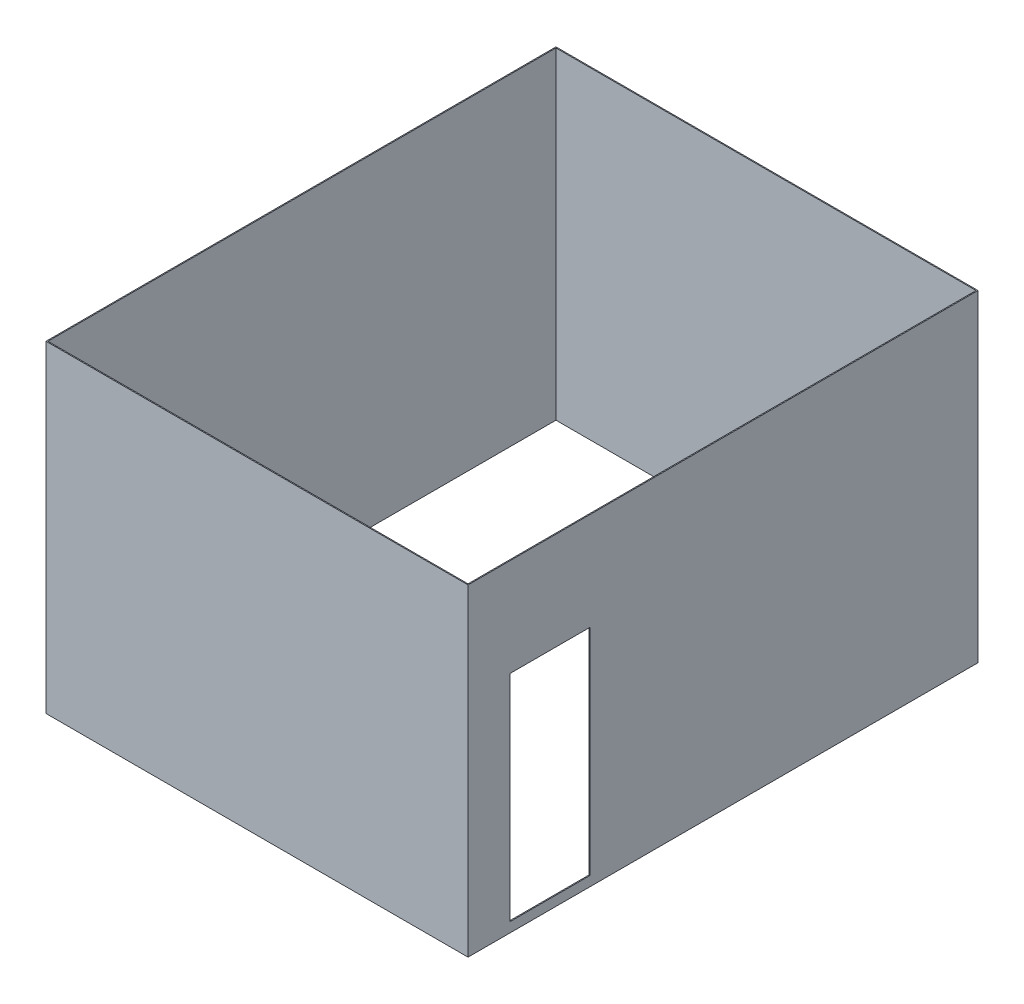
from build123d import *

# Parameters (mm, degrees)
SKETCH_1_W          = 432
SKETCH_1_H          = 522
SKETCH_1_W_2        = 430
SKETCH_1_H_2        = 520
EXTRUDE_2_DEPTH     = 330
SKETCH_2_W          = 82
SKETCH_2_H          = 220
CUT_EXTRUDE_2_DEPTH = 10


with BuildPart() as part:
    # Эскиз1 → Вытянуть-Тонкостенный2 (new body)
    with BuildSketch(Plane(origin=(0, 0, 0), x_dir=(1, 0, 0), z_dir=(0, 1, 0))):
        with Locations((-215, 260)):
            Rectangle(SKETCH_1_W, SKETCH_1_H)
        with Locations((-215, 260)):
            Rectangle(SKETCH_1_W_2, SKETCH_1_H_2, mode=Mode.SUBTRACT)
    extrude(amount=EXTRUDE_2_DEPTH)

    # Эскиз2 → Вырез-Вытянуть2 (cut)
    with BuildSketch(Plane(origin=(1, 0, 0), x_dir=(0, 0, -1), z_dir=(1, 0, 0))):
        with Locations((83, 120)):
            Rectangle(SKETCH_2_W, SKETCH_2_H)
    extrude(amount=-CUT_EXTRUDE_2_DEPTH, mode=Mode.SUBTRACT)


solid = part.part
